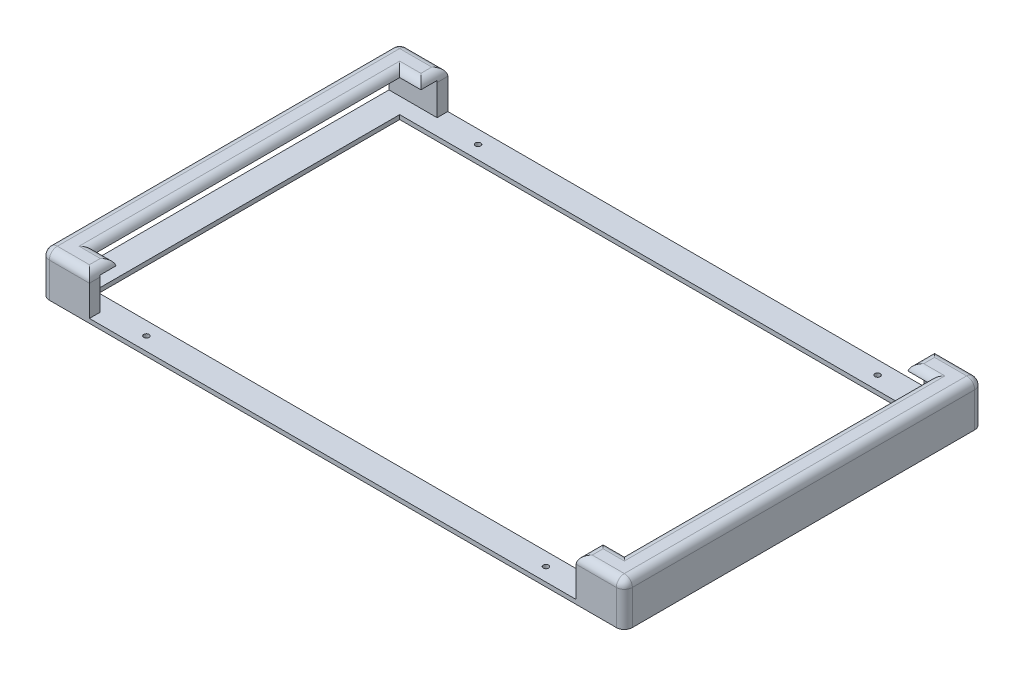
from build123d import *

# Parameters (mm, degrees)
SKETCH_219_W        = 218
SKETCH_219_H        = 134
SKETCH_219_W_2      = 198
SKETCH_219_H_2      = 114
EXTRUDE_2_DEPTH     = 16
SKETCH_2_W          = 126
SKETCH_2_H          = 12
CUT_EXTRUDE_1_DEPTH = 212
SKETCH_3_W          = 182
SKETCH_3_H          = 14.4
CUT_EXTRUDE_2_DEPTH = 134
SKETCH_4_R          = 1
CUT_EXTRUDE_3_DEPTH = 1.6
FILLET_1_R          = 3
FILLET_2_R          = 3
FILLET_3_R          = 3


with BuildPart() as part:
    # Sketch 219 → Бобышка-Вытянуть2 (new body)
    with BuildSketch(Plane(origin=(0, 0, 0), x_dir=(1, 0, 0), z_dir=(0, 1, 0))):
        Rectangle(SKETCH_219_W, SKETCH_219_H)
        Rectangle(SKETCH_219_W_2, SKETCH_219_H_2, mode=Mode.SUBTRACT)
    extrude(amount=EXTRUDE_2_DEPTH)

    # Эскиз2 → Вырез-Вытянуть1 (cut)
    with BuildSketch(Plane.ZY.offset(109)):
        with Locations((0, 7.6)):
            Rectangle(SKETCH_2_W, SKETCH_2_H)
    extrude(amount=-CUT_EXTRUDE_1_DEPTH, mode=Mode.SUBTRACT)

    # Эскиз3 → Вырез-Вытянуть2 (cut)
    with BuildSketch(Plane.XY.offset(67)):
        with Locations((0, 8.8)):
            Rectangle(SKETCH_3_W, SKETCH_3_H)
    extrude(amount=-CUT_EXTRUDE_2_DEPTH, mode=Mode.SUBTRACT)

    # Эскиз4 → Вырез-Вытянуть3 (cut)
    with BuildSketch(Plane(origin=(0, 1.6, 0), x_dir=(1, 0, 0), z_dir=(0, 1, 0))):
        with Locations(Location((-74.698916604, 62, 0), (0, 0, 270))):
            Circle(SKETCH_4_R)
        with Locations(Location((-74.698916604, -62, 0), (0, 0, 270))):
            Circle(SKETCH_4_R)
        with Locations(Location((74.698916604, -62, 0), (0, 0, 90))):
            Circle(SKETCH_4_R)
        with Locations(Location((74.698916604, 62, 0), (0, 0, 90))):
            Circle(SKETCH_4_R)
    extrude(amount=-CUT_EXTRUDE_3_DEPTH, mode=Mode.SUBTRACT)

    # Скругление1
    fillet_1_edges = [part.edges().sort_by_distance(p)[0] for p in [
        (109, 8, 67),
        (-109, 8, 67),
        (-109, 8, -67),
        (109, 8, -67),
    ]]
    fillet(fillet_1_edges, radius=FILLET_1_R)

    # Скругление2
    # the kernel refuses this fillet: 3 mm, written as the material it takes off along each edge
    with BuildSketch(Plane(origin=(-91, 16, -49.5), x_dir=(-1, 0, 0), z_dir=(0, 0, -1)), Plane(origin=(-91, 16, 74.5), x_dir=(-1, 0, 0), z_dir=(0, 0, -1))) as fillet_2_piece_1:
        with BuildLine():
            CenterArc((FILLET_2_R, -FILLET_2_R), FILLET_2_R, 90, 90)
            Line((0, -FILLET_2_R), (0, 0))
            Line((0, 0), (FILLET_2_R, 0))
        make_face()
    extrude(amount=25, mode=Mode.SUBTRACT)
    with BuildSketch(Plane(origin=(-83.651530772, 16, -57), x_dir=(0, 0, -1), z_dir=(-1, 0, 0)), Plane(origin=(-99, 16, 57), x_dir=(0, 0, 1), z_dir=(1, 0, 0))) as fillet_2_piece_2:
        with BuildLine():
            CenterArc((2.939387691, 3), FILLET_2_R, 191.536959033, 78.463040967)
            Line((0, 2.4), (0, 0))
            Line((0, 0), (2.939387691, 0))
        make_face()
    extrude(amount=15.348469228, mode=Mode.SUBTRACT)
    with BuildSketch(Plane(origin=(-99, 16, -57), x_dir=(-1, 0, 0), z_dir=(0, 0, 1))) as fillet_2_piece_3:
        with BuildLine():
            CenterArc((2.939387691, 3), FILLET_2_R, 191.536959033, 78.463040967)
            Line((0, 2.4), (0, 0))
            Line((0, 0), (2.939387691, 0))
        make_face()
    extrude(amount=114, mode=Mode.SUBTRACT)
    with BuildSketch(Plane(origin=(-106, 16, 67), x_dir=(0, -1, 0), z_dir=(1, 0, 0))) as fillet_2_piece_4:
        with BuildLine():
            CenterArc((FILLET_2_R, FILLET_2_R), FILLET_2_R, 180, 90)
            Line((0, FILLET_2_R), (0, 0))
            Line((0, 0), (FILLET_2_R, 0))
        make_face()
    extrude(amount=22.5, mode=Mode.SUBTRACT)
    with BuildSketch(Plane(origin=(-106, 16, 64), x_dir=(0, 0, 1), z_dir=(1, 0, 0))) as fillet_2_piece_5:
        with BuildLine():
            CenterArc((3 - FILLET_2_R, FILLET_2_R), FILLET_2_R, 270, 90)
            Line((3 - FILLET_2_R, 0), (3, 0))
            Line((3, 0), (3, FILLET_2_R))
        make_face()
    revolve(axis=Axis((-106, 16, 64), (0, -1, 0)), revolution_arc=90, mode=Mode.SUBTRACT)
    with BuildSketch(Plane(origin=(-109, 16, -64), x_dir=(1, 0, 0), z_dir=(0, 0, 1))) as fillet_2_piece_6:
        with BuildLine():
            CenterArc((FILLET_2_R, -FILLET_2_R), FILLET_2_R, 90, 90)
            Line((0, -FILLET_2_R), (0, 0))
            Line((0, 0), (FILLET_2_R, 0))
        make_face()
    extrude(amount=128, mode=Mode.SUBTRACT)
    with BuildSketch(Plane(origin=(-106, 16, -64), x_dir=(-1, 0, 0), z_dir=(0, 0, 1))) as fillet_2_piece_7:
        with BuildLine():
            CenterArc((3 - FILLET_2_R, FILLET_2_R), FILLET_2_R, 270, 90)
            Line((3, FILLET_2_R), (3, 0))
            Line((3, 0), (3 - FILLET_2_R, 0))
        make_face()
    revolve(axis=Axis((-106, 16, -64), (0, -1, 0)), revolution_arc=90, mode=Mode.SUBTRACT)
    with BuildSketch(Plane(origin=(-83.5, 16, -67), x_dir=(0, 0, 1), z_dir=(-1, 0, 0))) as fillet_2_piece_8:
        with BuildLine():
            CenterArc((FILLET_2_R, -FILLET_2_R), FILLET_2_R, 90, 90)
            Line((0, -FILLET_2_R), (0, 0))
            Line((0, 0), (FILLET_2_R, 0))
        make_face()
    extrude(amount=22.5, mode=Mode.SUBTRACT)
    with BuildSketch(Plane(origin=(-91, 16, -57), x_dir=(0, 0, -1), z_dir=(-1, 0, 0))) as fillet_2_piece_9a_section:
        with BuildLine():
            CenterArc((2.939387691, 3), FILLET_2_R, 191.536959033, 78.463040967)
            Line((0, 2.4), (0, 0))
            Line((0, 0), (2.939387691, 0))
        make_face()
    fillet_2_piece_9a = extrude(amount=15.348469228, mode=Mode.PRIVATE)
    fillet_2_piece_9a = split(fillet_2_piece_9a, bisect_by=Plane(origin=(-99, 16, -57), z_dir=(-1, 0, 0)), keep=Keep.TOP, mode=Mode.PRIVATE)
    with BuildSketch(Plane(origin=(-99, 16, -64.348469228), x_dir=(-1, 0, 0), z_dir=(0, 0, 1))) as fillet_2_piece_9b_section:
        with BuildLine():
            CenterArc((2.939387691, 3), FILLET_2_R, 191.536959033, 78.463040967)
            Line((0, 2.4), (0, 0))
            Line((0, 0), (2.939387691, 0))
        make_face()
    fillet_2_piece_9b = extrude(amount=121.348469228, mode=Mode.PRIVATE)
    fillet_2_piece_9b = split(fillet_2_piece_9b, bisect_by=Plane(origin=(-99, 16, -57), z_dir=(0, 0, -1)), keep=Keep.TOP, mode=Mode.PRIVATE)
    fillet_2_piece_9b = split(fillet_2_piece_9b, bisect_by=Plane(origin=(-99, 16, -63), z_dir=(0, 0, 1)), keep=Keep.TOP, mode=Mode.PRIVATE)
    fillet_2_piece_9 = fillet_2_piece_9a & fillet_2_piece_9b
    add(fillet_2_piece_9, mode=Mode.SUBTRACT)
    with BuildSketch(Plane(origin=(-106.348469228, 16, 57), x_dir=(0, 0, 1), z_dir=(1, 0, 0))) as fillet_2_piece_10a_section:
        with BuildLine():
            CenterArc((2.939387691, 3), FILLET_2_R, 191.536959033, 78.463040967)
            Line((0, 2.4), (0, 0))
            Line((0, 0), (2.939387691, 0))
        make_face()
    fillet_2_piece_10a = extrude(amount=15.348469228, mode=Mode.PRIVATE)
    fillet_2_piece_10a = split(fillet_2_piece_10a, bisect_by=Plane(origin=(-99, 16, 57), z_dir=(-1, 0, 0)), keep=Keep.TOP, mode=Mode.PRIVATE)
    with BuildSketch(Plane(origin=(-99, 16, -57), x_dir=(-1, 0, 0), z_dir=(0, 0, 1))) as fillet_2_piece_10b_section:
        with BuildLine():
            CenterArc((2.939387691, 3), FILLET_2_R, 191.536959033, 78.463040967)
            Line((0, 2.4), (0, 0))
            Line((0, 0), (2.939387691, 0))
        make_face()
    fillet_2_piece_10b = extrude(amount=121.348469228, mode=Mode.PRIVATE)
    fillet_2_piece_10b = split(fillet_2_piece_10b, bisect_by=Plane(origin=(-99, 16, 57), z_dir=(0, 0, 1)), keep=Keep.TOP, mode=Mode.PRIVATE)
    fillet_2_piece_10b = split(fillet_2_piece_10b, bisect_by=Plane(origin=(-99, 16, 63), z_dir=(0, 0, -1)), keep=Keep.TOP, mode=Mode.PRIVATE)
    fillet_2_piece_10 = fillet_2_piece_10a & fillet_2_piece_10b
    add(fillet_2_piece_10, mode=Mode.SUBTRACT)

    # Скругление3
    # the kernel refuses this fillet: 3 mm, written as the material it takes off along each edge
    with BuildSketch(Plane(origin=(106, 16, 64), x_dir=(0, 0, 1), z_dir=(-1, 0, 0))) as fillet_3_piece_1:
        with BuildLine():
            CenterArc((3 - FILLET_3_R, -FILLET_3_R), FILLET_3_R, 0, 90)
            Line((3, -FILLET_3_R), (3, 0))
            Line((3, 0), (3 - FILLET_3_R, 0))
        make_face()
    revolve(axis=Axis((106, 16, 64), (0, 1, 0)), revolution_arc=90, mode=Mode.SUBTRACT)
    with BuildSketch(Plane(origin=(83.5, 16, 67), x_dir=(0, -1, 0), z_dir=(1, 0, 0)), Plane(origin=(106, 16, -67), x_dir=(0, -1, 0), z_dir=(-1, 0, 0))) as fillet_3_piece_2:
        with BuildLine():
            CenterArc((FILLET_3_R, FILLET_3_R), FILLET_3_R, 180, 90)
            Line((0, FILLET_3_R), (0, 0))
            Line((0, 0), (FILLET_3_R, 0))
        make_face()
    extrude(amount=22.5, mode=Mode.SUBTRACT)
    with BuildSketch(Plane(origin=(91, 16, 74.5), x_dir=(0, -1, 0), z_dir=(0, 0, -1)), Plane(origin=(91, 16, -49.5), x_dir=(0, -1, 0), z_dir=(0, 0, -1))) as fillet_3_piece_3:
        with BuildLine():
            CenterArc((FILLET_3_R, -FILLET_3_R), FILLET_3_R, 90, 90)
            Line((0, -FILLET_3_R), (0, 0))
            Line((0, 0), (FILLET_3_R, 0))
        make_face()
    extrude(amount=25, mode=Mode.SUBTRACT)
    with BuildSketch(Plane(origin=(83.651530772, 16, 57), x_dir=(0, -1.0, 1.5720758028687117e-12), z_dir=(1, 0, 0)), Plane(origin=(99, 16, -57), x_dir=(0, -1.0, -1.5750363976010446e-12), z_dir=(-1, 0, 0))) as fillet_3_piece_4:
        with BuildLine():
            CenterArc((3, -2.939387691), FILLET_3_R, 101.536959033, 78.463040967)
            Line((0, -2.939387691), (0, 0))
            Line((0, 0), (2.4, 0))
        make_face()
    extrude(amount=15.348469228, mode=Mode.SUBTRACT)
    with BuildSketch(Plane(origin=(99, 16, 57), x_dir=(1.56911520813638e-12, -1.0, 0), z_dir=(0, 0, -1))) as fillet_3_piece_5:
        with BuildLine():
            CenterArc((3, -2.939387691), FILLET_3_R, 101.536959033, 78.463040967)
            Line((0, -2.939387691), (0, 0))
            Line((0, 0), (2.4, 0))
        make_face()
    extrude(amount=114, mode=Mode.SUBTRACT)
    with BuildSketch(Plane(origin=(106, 16, -64), x_dir=(1, 0, 0), z_dir=(0, 0, 1))) as fillet_3_piece_6:
        with BuildLine():
            CenterArc((3 - FILLET_3_R, -FILLET_3_R), FILLET_3_R, 0, 90)
            Line((3 - FILLET_3_R, 0), (3, 0))
            Line((3, 0), (3, -FILLET_3_R))
        make_face()
    revolve(axis=Axis((106, 16, -64), (0, 1, 0)), revolution_arc=90, mode=Mode.SUBTRACT)
    with BuildSketch(Plane(origin=(109, 16, 64), x_dir=(0, -1, 0), z_dir=(0, 0, -1))) as fillet_3_piece_7:
        with BuildLine():
            CenterArc((FILLET_3_R, FILLET_3_R), FILLET_3_R, 180, 90)
            Line((0, FILLET_3_R), (0, 0))
            Line((0, 0), (FILLET_3_R, 0))
        make_face()
    extrude(amount=128, mode=Mode.SUBTRACT)
    with BuildSketch(Plane(origin=(91, 16, 57), x_dir=(0, -1.0, 1.5720758028687117e-12), z_dir=(1, 0, 0))) as fillet_3_piece_8a_section:
        with BuildLine():
            CenterArc((3, -2.939387691), FILLET_3_R, 101.536959033, 78.463040967)
            Line((0, -2.939387691), (0, 0))
            Line((0, 0), (2.4, 0))
        make_face()
    fillet_3_piece_8a = extrude(amount=15.348469228, mode=Mode.PRIVATE)
    fillet_3_piece_8a = split(fillet_3_piece_8a, bisect_by=Plane(origin=(103, 16, 57), z_dir=(-1, 0, 0)), keep=Keep.TOP, mode=Mode.PRIVATE)
    fillet_3_piece_8a = split(fillet_3_piece_8a, bisect_by=Plane(origin=(99, 16, 57), z_dir=(1, 0, 0)), keep=Keep.TOP, mode=Mode.PRIVATE)
    with BuildSketch(Plane(origin=(99, 16, 64.348469228), x_dir=(1.56911520813638e-12, -1.0, 0), z_dir=(0, 0, -1))) as fillet_3_piece_8b_section:
        with BuildLine():
            CenterArc((3, -2.939387691), FILLET_3_R, 101.536959033, 78.463040967)
            Line((0, -2.939387691), (0, 0))
            Line((0, 0), (2.4, 0))
        make_face()
    fillet_3_piece_8b = extrude(amount=121.348469228, mode=Mode.PRIVATE)
    fillet_3_piece_8b = split(fillet_3_piece_8b, bisect_by=Plane(origin=(99, 16, 63), z_dir=(0, 0, -1)), keep=Keep.TOP, mode=Mode.PRIVATE)
    fillet_3_piece_8b = split(fillet_3_piece_8b, bisect_by=Plane(origin=(99, 16, 57), z_dir=(0, 0, 1)), keep=Keep.TOP, mode=Mode.PRIVATE)
    fillet_3_piece_8 = fillet_3_piece_8a & fillet_3_piece_8b
    add(fillet_3_piece_8, mode=Mode.SUBTRACT)
    with BuildSketch(Plane(origin=(99, 16, 57), x_dir=(1.56911520813638e-12, -1.0, 0), z_dir=(0, 0, -1))) as fillet_3_piece_9a_section:
        with BuildLine():
            CenterArc((3, -2.939387691), FILLET_3_R, 101.536959033, 78.463040967)
            Line((0, -2.939387691), (0, 0))
            Line((0, 0), (2.4, 0))
        make_face()
    fillet_3_piece_9a = extrude(amount=121.348469228, mode=Mode.PRIVATE)
    fillet_3_piece_9a = split(fillet_3_piece_9a, bisect_by=Plane(origin=(99, 16, -63), z_dir=(0, 0, 1)), keep=Keep.TOP, mode=Mode.PRIVATE)
    fillet_3_piece_9a = split(fillet_3_piece_9a, bisect_by=Plane(origin=(99, 16, -57), z_dir=(0, 0, -1)), keep=Keep.TOP, mode=Mode.PRIVATE)
    with BuildSketch(Plane(origin=(106.348469228, 16, -57), x_dir=(0, -1.0, -1.5750363976010446e-12), z_dir=(-1, 0, 0))) as fillet_3_piece_9b_section:
        with BuildLine():
            CenterArc((3, -2.939387691), FILLET_3_R, 101.536959033, 78.463040967)
            Line((0, -2.939387691), (0, 0))
            Line((0, 0), (2.4, 0))
        make_face()
    fillet_3_piece_9b = extrude(amount=15.348469228, mode=Mode.PRIVATE)
    fillet_3_piece_9b = split(fillet_3_piece_9b, bisect_by=Plane(origin=(103, 16, -57), z_dir=(-1, 0, 0)), keep=Keep.TOP, mode=Mode.PRIVATE)
    fillet_3_piece_9b = split(fillet_3_piece_9b, bisect_by=Plane(origin=(99, 16, -57), z_dir=(1, 0, 0)), keep=Keep.TOP, mode=Mode.PRIVATE)
    fillet_3_piece_9 = fillet_3_piece_9a & fillet_3_piece_9b
    add(fillet_3_piece_9, mode=Mode.SUBTRACT)


solid = part.part
